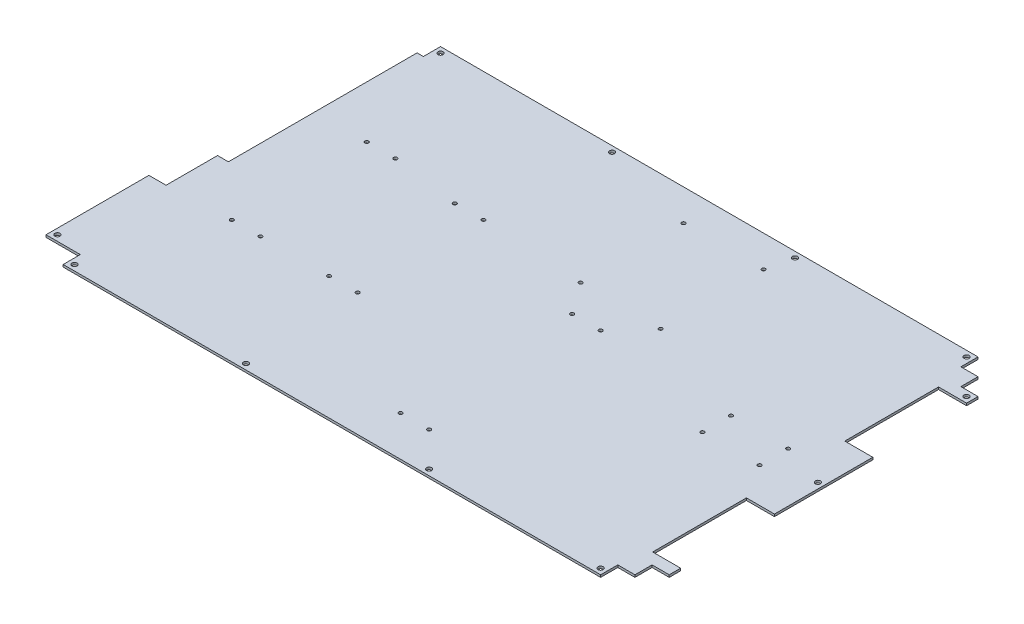
from build123d import *

# Parameters (mm, degrees)
BASE_FLANGE1_DEPTH       = 2
SKETCH3_W                = 15
SKETCH3_H                = 15
TAB1_DEPTH               = 2
CUT_EXTRUDE1_REACH       = 314.176
SKETCH4_W                = 15
SKETCH4_H                = 45
M4_CLEARANCE_HOLE1_D     = 4.5
M4_CLEARANCE_HOLE1_DEPTH = 2
M3_CLEARANCE_HOLE1_D     = 3.2
CUT_EXTRUDE2_REACH       = 314.176
SKETCH10_W               = 24.5
SKETCH10_H               = 82
CUT_EXTRUDE3_REACH       = 314.176
SKETCH11_W               = 24.5
SKETCH11_H               = 165


# Sheet-metal steps are written as plain solids
with BuildPart() as part:
    # Sketch1 → Base-Flange1 (new body)
    with BuildSketch(Plane(origin=(0, 0, 0), x_dir=(1, 0, 0), z_dir=(0, 1, 0))):
        Polygon((-250, -150), (-235, -150), (-235, -165), (235, -165), (235, -150), (250, -150), (250, -135), (265, -135), (265, 135), (250, 135), (250, 150), (235, 150), (235, 165), (-235, 165), (-235, 150), (-250, 150), (-250, 135), (-265, 135), (-265, -135), (-250, -135), align=None)
    extrude(amount=-BASE_FLANGE1_DEPTH)

    # Sketch3 → Tab1 (add)
    with BuildSketch(Plane(origin=(0, 0, 0), x_dir=(1, 0, 0), z_dir=(0, 1, 0))):
        with Locations((-257.5, -142.5)):
            Rectangle(SKETCH3_W, SKETCH3_H)
    extrude(amount=-TAB1_DEPTH)

    # Sketch4 → Cut-Extrude1 (cut, up to next)
    with BuildSketch(Plane(origin=(0, 0, 0), x_dir=(1, 0, 0), z_dir=(0, 1, 0)), mode=Mode.PRIVATE) as cut_extrude1_sk1:
        with Locations((-257.5, -37.5)):
            Rectangle(SKETCH4_W, SKETCH4_H)
    cut_extrude1_tool1 = extrude(cut_extrude1_sk1.sketch, amount=-CUT_EXTRUDE1_REACH, mode=Mode.PRIVATE) & part.part
    add(cut_extrude1_tool1.solids().sort_by_distance((-257.5, 0, 37.5))[0], mode=Mode.SUBTRACT)

    # M4 Clearance Hole1
    with Locations(Plane(origin=(0, 0, 0), x_dir=(1, 0, 0), z_dir=(0, 1, 0))):
        with Locations((-260, -145), (-260, 0), (-260, 130), (-230, 160), (-80, 160), (80, 160), (230, 160), (260, 130), (260, 0), (260, -145), (230, -160), (80, -160), (-80, -160), (-230, -160)):
            Hole(M4_CLEARANCE_HOLE1_D / 2, depth=M4_CLEARANCE_HOLE1_DEPTH)

    # M3 Clearance Hole1 (through all)
    with Locations(Plane(origin=(0, 0, 0), x_dir=(1, 0, 0), z_dir=(0, 1, 0))):
        with Locations((221.5, -12.5), (171.5, -12.5), (171.5, 12.5), (221.5, 12.5), (75, 137.5), (5, 47.5), (75, 47.5), (5, 137.5), (-85, 52.5), (-110, -57.5), (-85, -57.5), (-110, 52.5), (-170, -57.5), (-195, 60.5), (-170, 60.5), (-195, -57.5), (25, 20), (50, -130), (25, -130), (50, 20)):
            Hole(M3_CLEARANCE_HOLE1_D / 2)

    # Sketch10 → Cut-Extrude2 (cut, up to next)
    with BuildSketch(Plane(origin=(0, 0, 0), x_dir=(1, 0, 0), z_dir=(0, 1, 0)), mode=Mode.PRIVATE) as cut_extrude2_sk1:
        with Locations((252.75, 84)):
            Rectangle(SKETCH10_W, SKETCH10_H)
    cut_extrude2_tool1 = extrude(cut_extrude2_sk1.sketch, amount=-CUT_EXTRUDE2_REACH, mode=Mode.PRIVATE) & part.part
    # Sketch10 → Cut-Extrude2 (cut, up to next)
    with BuildSketch(Plane(origin=(0, 0, 0), x_dir=(1, 0, 0), z_dir=(0, 1, 0)), mode=Mode.PRIVATE) as cut_extrude2_sk2:
        with Locations((252.75, -84)):
            Rectangle(SKETCH10_W, SKETCH10_H)
    cut_extrude2_tool2 = extrude(cut_extrude2_sk2.sketch, amount=-CUT_EXTRUDE2_REACH, mode=Mode.PRIVATE) & part.part
    add(cut_extrude2_tool1.solids().sort_by_distance((252.75, 0, -84))[0], mode=Mode.SUBTRACT)
    add(cut_extrude2_tool2.solids().sort_by_distance((252.75, 0, 84))[0], mode=Mode.SUBTRACT)

    # Sketch11 → Cut-Extrude3 (cut, up to next)
    with BuildSketch(Plane(origin=(0, 0, 0), x_dir=(1, 0, 0), z_dir=(0, 1, 0)), mode=Mode.PRIVATE) as cut_extrude3_sk1:
        with Locations((-252.75, 67.5)):
            Rectangle(SKETCH11_W, SKETCH11_H)
    cut_extrude3_tool1 = extrude(cut_extrude3_sk1.sketch, amount=-CUT_EXTRUDE3_REACH, mode=Mode.PRIVATE) & part.part
    add(cut_extrude3_tool1.solids().sort_by_distance((-252.75, 0, -67.5))[0], mode=Mode.SUBTRACT)


solid = part.part
